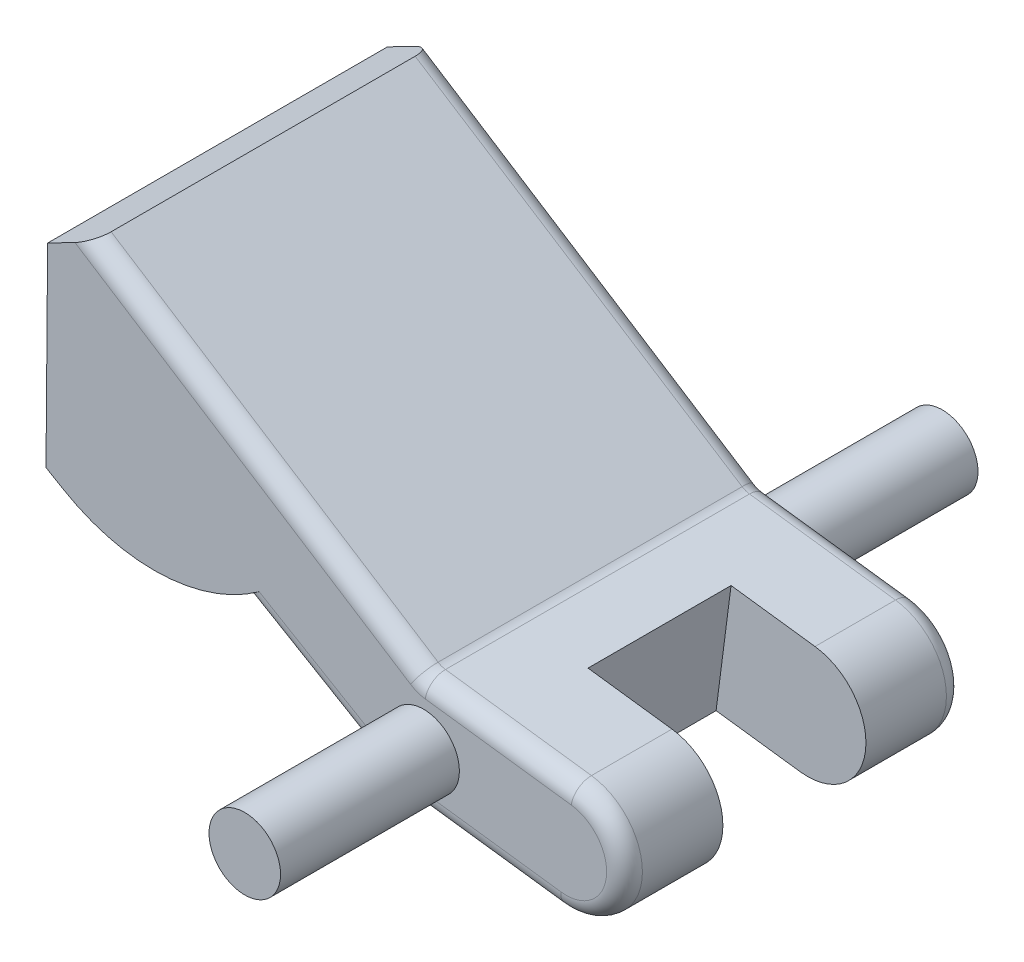
from build123d import *

# Parameters (mm, degrees)
BOSS_EXTRUDE1_DEPTH = 9.5
SKETCH2_R           = 2
BOSS_EXTRUDE2_DEPTH = 19.5
SKETCH7_W           = 10
SKETCH7_H           = 5
CUT_EXTRUDE3_DEPTH  = 31.276334221
SKETCH5_R           = 3.302
SKETCH5_R_2         = 2.413
CUT_EXTRUDE2_DEPTH  = 3.5
FILLET3_R           = 10
FILLET1_R           = 1
FILLET2_R           = 1
SKETCH9_W           = 8
SKETCH9_H           = 8
CUT_EXTRUDE5_DEPTH  = 6.532330181
CHAMFER1_SIZE       = 3
CHAMFER1_SIZE_2     = 2.938727652


# Some blends are built 0.0001 mm under size
with BuildPart() as part:
    # Sketch1 → Boss-Extrude1 (new, symmetric)
    with BuildSketch(Plane.XY):
        with BuildLine():
            Line((0, 3.561668795), (-21, 17))
            Line((-21, 17), (-21.115416888, 3.14407423))
            Line((-21.115416888, 3.14407423), (-12.675875805, -1.822682799))
            Line((-12.675875805, -1.822682799), (-10.139894754, 2.486470263))
            Line((-10.139894754, 2.486470263), (-1.52158863, -2.585491837))
            ThreePointArc((-1.52158863, -2.585491837), (-0.972654449, -2.837947026), (-0.384266987, -2.975288034))
            Line((-0.384266987, -2.975288034), (7.549834435, -4))
            ThreePointArc((7.549834435, -4), (11.207454879, -1.17909917), (8.386554049, 2.478521273))
            Line((8.386554049, 2.478521273), (0, 3.561668795))
        make_face()
    extrude(amount=BOSS_EXTRUDE1_DEPTH, both=True)

    # Sketch2 → Boss-Extrude2 (add, symmetric)
    with BuildSketch(Plane.XY):
        with Locations(Location((0, 0, 0), (0, 0, 180))):
            Circle(SKETCH2_R)
    extrude(amount=BOSS_EXTRUDE2_DEPTH, both=True)

    # Sketch7 → Cut-Extrude3 (cut, through all)
    with BuildSketch(Plane(origin=(-8.618306124, 5.071962101, 0), x_dir=(0, 0, -1), z_dir=(0.8618306124209184, -0.5071962100550289, 0))):
        with Locations((0, -5.5)):
            Rectangle(SKETCH7_W, SKETCH7_H)
    extrude(amount=-CUT_EXTRUDE3_DEPTH, mode=Mode.SUBTRACT)

    # Sketch5 → Cut-Extrude2 (cut)
    with BuildSketch(Plane(origin=(-1.52158863, -2.585491837, 0), x_dir=(0.8618306124209184, -0.5071962100550289, 0), z_dir=(-0.5071962100550289, -0.8618306124209184, 0))):
        with Locations((-16.27, 0)):
            Circle(SKETCH5_R)
        with Locations((-16.27, 0)):
            Circle(SKETCH5_R_2, mode=Mode.SUBTRACT)
    extrude(amount=-CUT_EXTRUDE2_DEPTH, mode=Mode.SUBTRACT)

    # Fillet3
    # the kernel refuses this fillet: 10 mm, written as the material it takes off along each edge
    with BuildSketch(Plane(origin=(-12.675875805, -1.822682799, -31.150635095), x_dir=(-0.8618306124209182, 0.507196210055029, 0), z_dir=(0, 0, 1)), Plane(origin=(-12.675875805, -1.822682799, -16.650635095), x_dir=(-0.8618306124209182, 0.507196210055029, 0), z_dir=(0, 0, 1))) as fillet3_piece_1:
        with BuildLine():
            CenterArc((8.660254038, -10), FILLET3_R, 90, 60)
            Line((0, -5), (0, 0))
            Line((0, 0), (8.660254038, 0))
        make_face()
    extrude(amount=47.801270189, mode=Mode.SUBTRACT)

    # Fillet1
    fillet1_edges = [part.edges().sort_by_distance(p)[0] for p in [
        (-18.389337376, 7.341352386, 0),
        (-17.623169962, 6.890454955, 0),
    ]]
    fillet(fillet1_edges, radius=FILLET1_R)

    # Fillet2
    fillet2_edges = [part.edges().sort_by_distance(p)[0] for p in [
        (-0.972654449, -2.837947026, -9.5),
        (-5.830741692, -0.049510787, -9.5),
        (-10.5, 10.280834397, -9.5),
        (4.193277024, 3.020095034, -9.5),
        (0, 3.561668795, 0),
        (-5.830741692, -0.049510787, 9.5),
        (-0.972654449, -2.837947026, 9.5),
        (3.582783724, -3.487644017, 9.5),
        (11.207454879, -1.17909917, 9.5),
        (4.193277024, 3.020095034, 9.5),
        (-10.5, 10.280834397, 9.5),
        (11.207454879, -1.17909917, -9.5),
        (3.582783724, -3.487644017, -9.5),
    ]]
    fillet(fillet2_edges, radius=FILLET2_R - 0.0001)  # a hair under: the kernel refuses the full size

    # Sketch9 → Cut-Extrude5 (cut)
    with BuildSketch(Plane(origin=(0.452452626, 3.50323324, 0), x_dir=(0.9917626778378904, -0.12808899581079106, 0), z_dir=(0.12808899581079106, 0.9917626778378904, 0))):
        with Locations((7.266165091, 0)):
            Rectangle(SKETCH9_W, SKETCH9_H)
    extrude(amount=-CUT_EXTRUDE5_DEPTH, mode=Mode.SUBTRACT)

    # Chamfer1
    # the kernel refuses this chamfer: 5.196152423, 3.337326817, 3, 2.938727652 mm, written as the material it takes off along each edge
    with BuildSketch(Plane(origin=(-21, 17, -16.154510493), x_dir=(0.8423017896549276, -0.5390062106730368, 0), z_dir=(0, 0, 1))) as chamfer1_piece_1:
        Polygon((CHAMFER1_SIZE, 0), (CHAMFER1_SIZE_2 * 0.531971562398, -CHAMFER1_SIZE_2 * 0.846762219836), (0, 0), align=None)
    extrude(amount=32.309020987, mode=Mode.SUBTRACT)


solid = part.part
